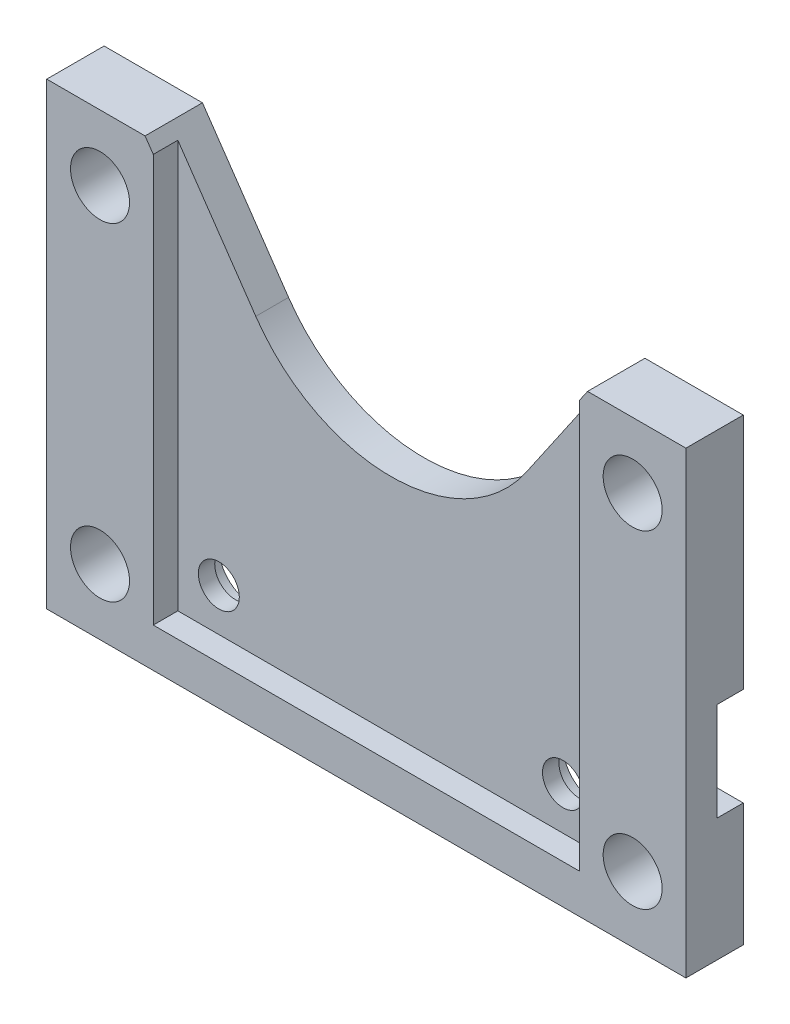
from build123d import *

# Parameters (mm, degrees)
SKETCH_1_R          = 1.25
SKETCH_1_R_2        = 1.8
EXTRUDE_1_DEPTH     = 2
SKETCH_3_R          = 1.8
EXTRUDE_2_DEPTH     = 1.5
SKETCH_4_R          = 2
CUT_EXTRUDE_1_DEPTH = 1
SKETCH_5_W          = 1.6
SKETCH_5_H          = 6
CUT_EXTRUDE_6_DEPTH = 46.412002819


with BuildPart() as part:
    # ｽｹｯﾁ1 → ﾎﾞｽ - 押し出し1 (new body)
    with BuildSketch(Plane.XY):
        with BuildLine():
            Line((19.5, -5), (-19.5, -5))
            Line((-19.5, -5), (-19.5, 23))
            Line((-19.5, 23), (-13.5, 23))
            Line((-13.5, 23), (-8.245593322, 15.342245077))
            ThreePointArc((-8.245593322, 15.342245077), (0, 11), (8.245593322, 15.342245077))
            Line((8.245593322, 15.342245077), (13.5, 23))
            Line((13.5, 23), (19.5, 23))
            Line((19.5, 23), (19.5, -5))
        make_face()
        with Locations((-10.5, 0)):
            Circle(SKETCH_1_R, mode=Mode.SUBTRACT)
        with Locations((10.5, 0)):
            Circle(SKETCH_1_R, mode=Mode.SUBTRACT)
        with Locations((-16.25, -1)):
            Circle(SKETCH_1_R_2, mode=Mode.SUBTRACT)
        with Locations((-16.25, 19)):
            Circle(SKETCH_1_R_2, mode=Mode.SUBTRACT)
        with Locations((16.25, -1)):
            Circle(SKETCH_1_R_2, mode=Mode.SUBTRACT)
        with Locations((16.25, 19)):
            Circle(SKETCH_1_R_2, mode=Mode.SUBTRACT)
    extrude(amount=EXTRUDE_1_DEPTH)

    # ｽｹｯﾁ3 → ﾎﾞｽ - 押し出し2 (add)
    with BuildSketch(Plane.XY.offset(2)):
        Polygon((-13, 22.271301653), (-13, -2.6), (13, -2.6), (13, 22.271301653), (13.5, 23), (19.5, 23), (19.5, -5), (-19.5, -5), (-19.5, 23), (-13.5, 23), align=None)
        with Locations((-16.25, 19)):
            Circle(SKETCH_3_R, mode=Mode.SUBTRACT)
        with Locations((-16.25, -1)):
            Circle(SKETCH_3_R, mode=Mode.SUBTRACT)
        with Locations((16.25, -1)):
            Circle(SKETCH_3_R, mode=Mode.SUBTRACT)
        with Locations((16.25, 19)):
            Circle(SKETCH_3_R, mode=Mode.SUBTRACT)
    extrude(amount=EXTRUDE_2_DEPTH)

    # ｽｹｯﾁ4 → ｶｯﾄ - 押し出し1 (cut)
    with BuildSketch(Plane(origin=(0, 0, 0), x_dir=(-1, 0, 0), z_dir=(0, 0, -1))):
        with Locations((-10.5, 0)):
            Circle(SKETCH_4_R)
        with Locations((10.5, 0)):
            Circle(SKETCH_4_R)
    extrude(amount=-CUT_EXTRUDE_1_DEPTH, mode=Mode.SUBTRACT)

    # ｽｹｯﾁ5 → ｶｯﾄ - 押し出し6 (cut, through all)
    with BuildSketch(Plane.ZY.offset(19.5)):
        with Locations((0.8, 5.5)):
            Rectangle(SKETCH_5_W, SKETCH_5_H)
    extrude(amount=-CUT_EXTRUDE_6_DEPTH, mode=Mode.SUBTRACT)


solid = part.part
